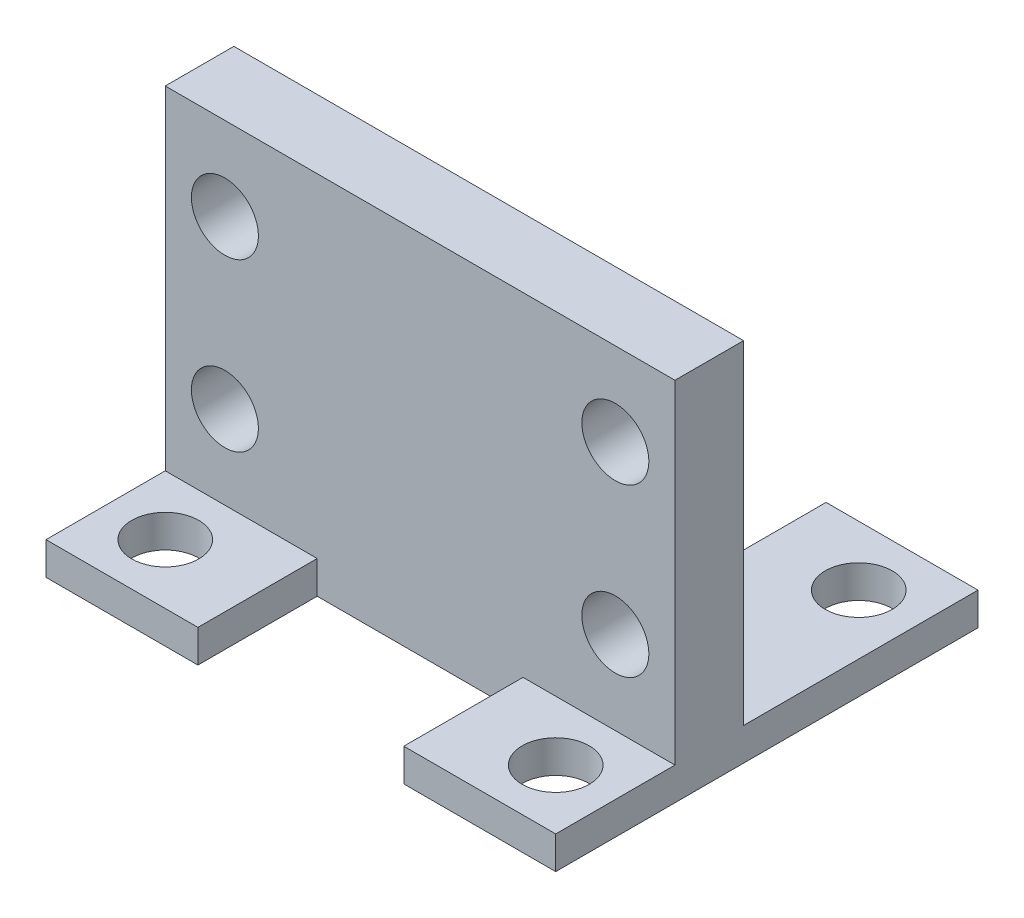
from build123d import *

# Parameters (mm, degrees)
SKETCH1_R               = 2.05
BOSS_EXTRUDE1_DEPTH     = 2
BOSS_EXTRUDE2_START     = 2
BOSS_EXTRUDE2_OUTLINE_W = 31.2
BOSS_EXTRUDE2_OUTLINE_H = 4.2
BOSS_EXTRUDE2_DEPTH     = 20.4
SKETCH2_R               = 2.05
CUT_EXTRUDE1_DEPTH      = 31.838976961


# Read off the part's stored shape, not the designer's step: Boss-Extrude2
with BuildPart() as part:
    # Sketch1 → Boss-Extrude1 (new body)
    with BuildSketch(Plane(origin=(0, 0, 0), x_dir=(1, 0, 0), z_dir=(0, 1, 0))):
        Polygon((-6.3, -5), (-6.3, 9.35), (-15.6, 9.35), (-15.6, -16.5), (-6.3, -16.5), (-6.3, -9.2), (6.3, -9.2), (6.3, -16.5), (15.6, -16.5), (15.6, 9.35), (6.3, 9.35), (6.3, -5), align=None)
        with Locations(Location((11.95, -12.85, 0), (0, 0, 270))):
            Circle(SKETCH1_R, mode=Mode.SUBTRACT)
        with Locations(Location((-11.95, -12.85, 0), (0, 0, 270))):
            Circle(SKETCH1_R, mode=Mode.SUBTRACT)
        with Locations(Location((11.95, 5.7, 0), (0, 0, 270))):
            Circle(SKETCH1_R, mode=Mode.SUBTRACT)
        with Locations(Location((-11.95, 5.7, 0), (0, 0, 270))):
            Circle(SKETCH1_R, mode=Mode.SUBTRACT)
    extrude(amount=BOSS_EXTRUDE1_DEPTH)

    # Boss-Extrude2 outline → Boss-Extrude2 (add)
    with BuildSketch(Plane(origin=(0, 0, 0), x_dir=(1, 0, 0), z_dir=(0, 1, 0)).offset(BOSS_EXTRUDE2_START)):
        with Locations((0, -7.1)):
            Rectangle(BOSS_EXTRUDE2_OUTLINE_W, BOSS_EXTRUDE2_OUTLINE_H)
    extrude(amount=BOSS_EXTRUDE2_DEPTH)

    # Sketch2 → Cut-Extrude1 (cut, through all)
    with BuildSketch(Plane(origin=(0, 0, 5), x_dir=(-1, 0, 0), z_dir=(0, 0, -1))):
        with Locations((-11.95, 7.1)):
            Circle(SKETCH2_R)
        with Locations((-11.95, 17.3)):
            Circle(SKETCH2_R)
        with Locations((11.95, 7.1)):
            Circle(SKETCH2_R)
        with Locations((11.95, 17.3)):
            Circle(SKETCH2_R)
    extrude(amount=-CUT_EXTRUDE1_DEPTH, mode=Mode.SUBTRACT)


solid = part.part
